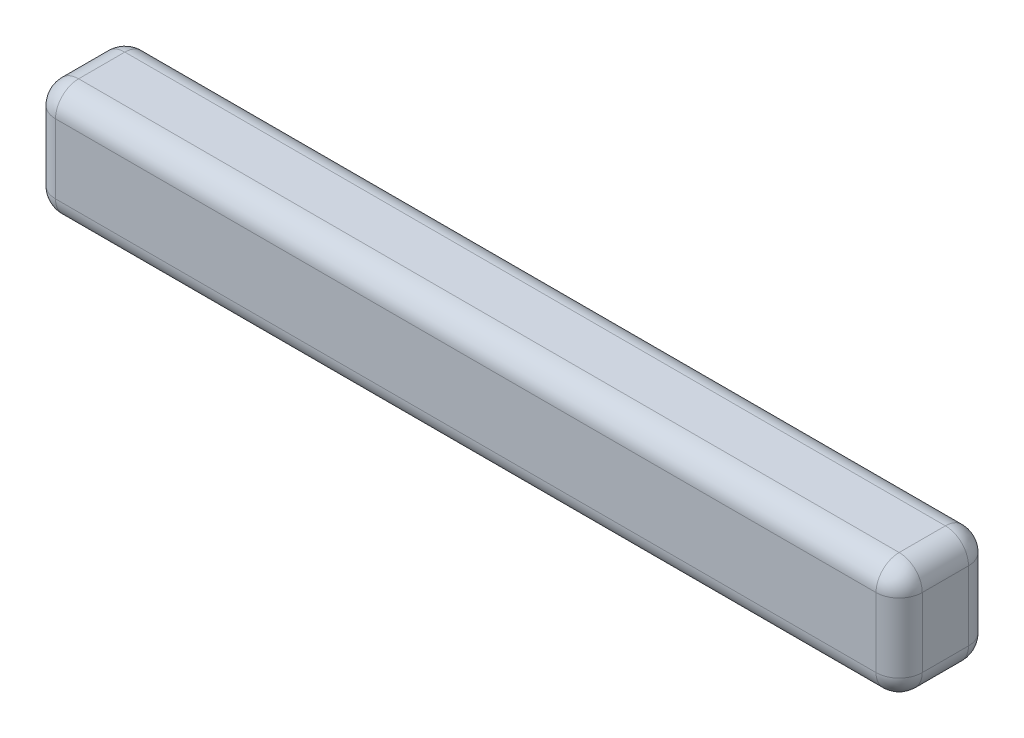
from build123d import *

# Parameters (mm, degrees)
SKETCH1_W           = 37.5
SKETCH1_H           = 4
BOSS_EXTRUDE1_DEPTH = 5
FILLET1_R           = 1


with BuildPart() as part:
    # Sketch1 → Boss-Extrude1 (new body)
    with BuildSketch(Plane(origin=(0, 0, 0), x_dir=(1, 0, 0), z_dir=(0, 1, 0))):
        Rectangle(SKETCH1_W, SKETCH1_H)
    extrude(amount=BOSS_EXTRUDE1_DEPTH)

    # Fillet1
    fillet1_edges = [part.edges().sort_by_distance(p)[0] for p in [
        (-18.75, 2.5, -2),
        (-18.75, 5, 0),
        (-18.75, 2.5, 2),
        (-18.75, 0, 0),
        (18.75, 2.5, 2),
        (18.75, 5, 0),
        (18.75, 2.5, -2),
        (18.75, 0, 0),
        (0, 0, 2),
        (0, 0, -2),
        (0, 5, -2),
        (0, 5, 2),
    ]]
    fillet(fillet1_edges, radius=FILLET1_R)


solid = part.part
